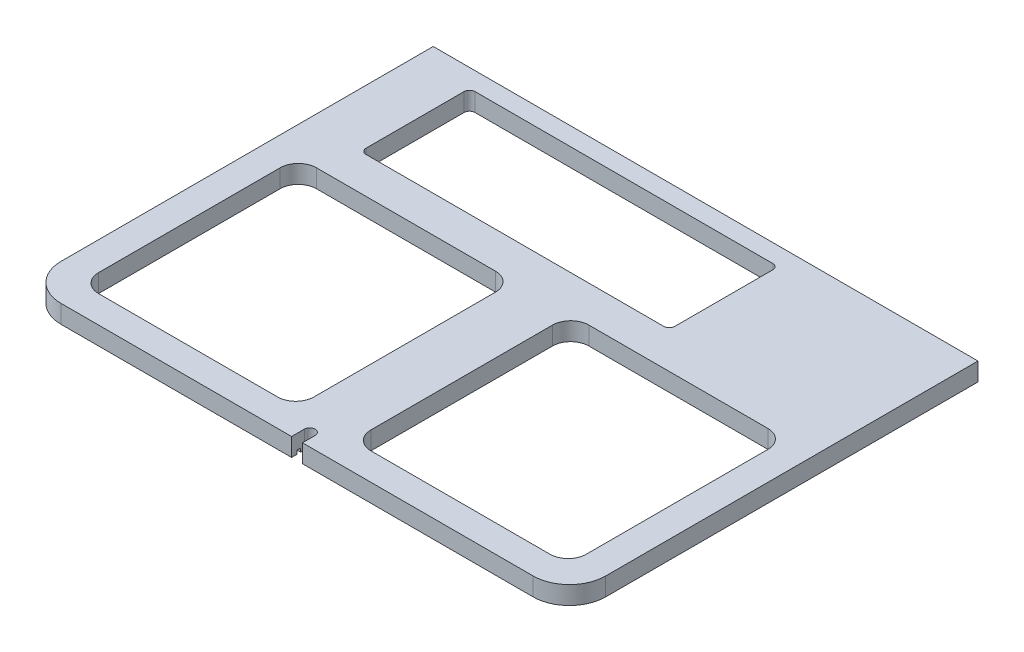
from build123d import *

# Parameters (mm, degrees)
SKIZZE1_W                       = 118.594243104
SKIZZE1_H                       = 120
LINEAR_AUSTRAGEN1_DEPTH         = 10
VERRUNDUNG2_R                   = 10
VERRUNDUNG2_OF_SPIEGELN1_R      = 10
SKIZZE3_W                       = 170
SKIZZE3_H                       = 60
SCHNITT_LINEAR_AUSTRAGEN1_DEPTH = 10
VERRUNDUNG3_R                   = 3
SCHNITT_LINEAR_AUSTRAGEN2_DEPTH = 10
SKIZZE5_W                       = 14
SKIZZE5_H                       = 2
SCHNITT_LINEAR_AUSTRAGEN3_DEPTH = 2


with BuildPart() as part:
    # Skizze1 → Linear austragen1 (new body)
    with BuildSketch(Plane(origin=(0, 10, 0), x_dir=(1, 0, 0), z_dir=(0, 1, 0))):
        with BuildLine():
            Line((0, -75), (130, -75))
            ThreePointArc((130, -75), (144.142135624, -69.142135624), (150, -55))
            Line((150, -55), (150, 75.702878448))
            Line((150, 75.702878448), (150, 150))
            Line((150, 150), (0, 150))
            Line((0, 150), (0, 75.702878448))
            Line((0, 75.702878448), (0, -75))
        make_face()
        with Locations((75, 0)):
            Rectangle(SKIZZE1_W, SKIZZE1_H, mode=Mode.SUBTRACT)
    linear_austragen1 = extrude(amount=LINEAR_AUSTRAGEN1_DEPTH)

    # Verrundung2
    verrundung2_edges = [part.edges().sort_by_distance(p)[0] for p in [
        (15.702878448, 15, 60),
        (134.297121552, 15, 60),
        (134.297121552, 15, -60),
        (15.702878448, 15, -60),
    ]]
    fillet(verrundung2_edges, radius=VERRUNDUNG2_R)

    # Spiegeln1: Linear austragen1 across plane
    add(linear_austragen1.mirror(Plane(origin=(0, 20, -150), x_dir=(0, 0, 1), z_dir=(1, 0, 0))))

    # Verrundung2 of Spiegeln1
    verrundung2_of_spiegeln1_edges = [part.edges().sort_by_distance(p)[0] for p in [
        (-15.702878448, 15, 60),
        (-134.297121552, 15, 60),
        (-134.297121552, 15, -60),
        (-15.702878448, 15, -60),
    ]]
    fillet(verrundung2_of_spiegeln1_edges, radius=VERRUNDUNG2_OF_SPIEGELN1_R)

    # Skizze3 → Schnitt-Linear austragen1 (cut)
    with BuildSketch(Plane.XZ.offset(-10)):
        with Locations((-35, -110)):
            Rectangle(SKIZZE3_W, SKIZZE3_H)
    extrude(amount=-SCHNITT_LINEAR_AUSTRAGEN1_DEPTH, mode=Mode.SUBTRACT)

    # Verrundung3
    verrundung3_edges = [part.edges().sort_by_distance(p)[0] for p in [
        (-120, 15, -140),
        (50, 15, -140),
        (50, 15, -80),
        (-120, 15, -80),
    ]]
    fillet(verrundung3_edges, radius=VERRUNDUNG3_R)

    # Skizze4 → Schnitt-Linear austragen2 (cut)
    with BuildSketch(Plane.XZ.offset(-10)):
        with BuildLine():
            Line((-3.000050853, 75), (-3.000050853, 68))
            ThreePointArc((-3.000050853, 68), (0.008683003, 65.000012713), (2.999898294, 68.017467638))
            Line((2.999898294, 68.017467638), (2.959241489, 75))
            Line((2.959241489, 75), (-3.000050853, 75))
        make_face()
    extrude(amount=-SCHNITT_LINEAR_AUSTRAGEN2_DEPTH, mode=Mode.SUBTRACT)

    # Skizze5 → Schnitt-Linear austragen3 (cut)
    with BuildSketch(Plane.XZ.offset(-10)):
        with Locations((-0.020404682, 71)):
            Rectangle(SKIZZE5_W, SKIZZE5_H)
    extrude(amount=-SCHNITT_LINEAR_AUSTRAGEN3_DEPTH, mode=Mode.SUBTRACT)


solid = part.part
